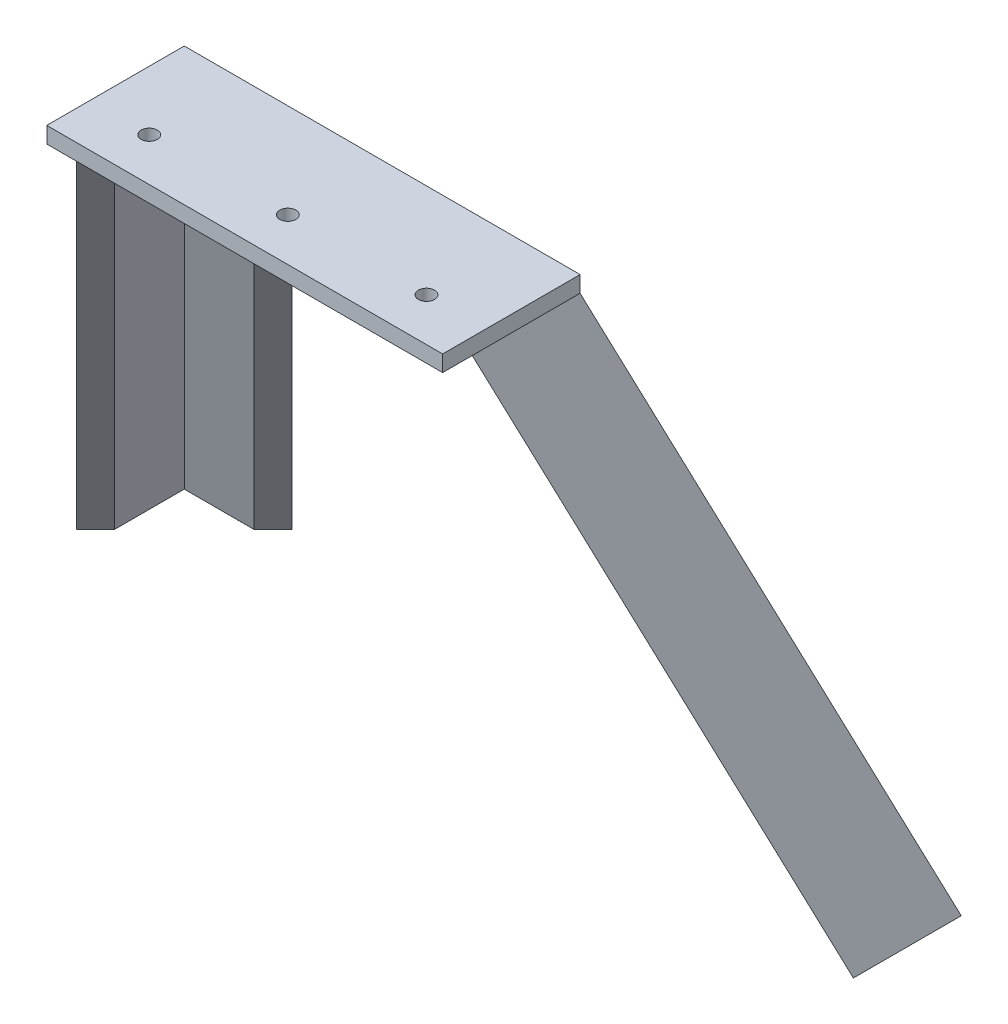
from build123d import *

# Parameters (mm, degrees)
SKETCH_8_W          = 73.42135624
SKETCH_8_H          = 25.5
EXTRUDE_3_DEPTH     = 3
SKETCH_9_R          = 1.5
CUT_EXTRUDE_2_DEPTH = 3


with BuildPart() as part:
    # 草图8 → 凸台-拉伸3 (new body)
    with BuildSketch(Plane(origin=(0, 100, 0), x_dir=(1, 0, 0), z_dir=(0, 1, 0))):
        with Locations((-11.084772404, 22.970398927)):
            Rectangle(SKETCH_8_W, SKETCH_8_H)
    extrude(amount=EXTRUDE_3_DEPTH)

    # 草图9 → 切除-拉伸2 (cut)
    with BuildSketch(Plane(origin=(0, 103, 0), x_dir=(1, 0, 0), z_dir=(0, 1, 0))):
        with Locations((-36.795450524, 18.220398927)):
            Circle(SKETCH_9_R)
        with Locations((14.625905716, 18.220398927)):
            Circle(SKETCH_9_R)
        with Locations((-11.084772404, 18.220398927)):
            Circle(SKETCH_9_R)
    extrude(amount=-CUT_EXTRUDE_2_DEPTH, mode=Mode.SUBTRACT)

    # 草图10 → 放样2 section 0
    with BuildSketch(Plane(origin=(0, 100, 0), x_dir=(1, 0, 0), z_dir=(0, 1, 0))):
        with BuildLine():
            Line((-47.795450524, 35.720398927), (-27.795450524, 35.720398927))
            Line((-27.795450524, 35.720398927), (-47.795450524, 15.720398927))
            Line((-47.795450524, 15.720398927), (-47.795450524, 35.720398927))
        make_face()
    # 草图11 → 放样2 section 1
    with BuildSketch(Plane(origin=(0, 0, 0), x_dir=(1, 0, 0), z_dir=(0, 1, 0))):
        with BuildLine():
            Line((-83.150789583, 71.075737986), (-63.150789583, 71.075737986))
            Line((-63.150789583, 71.075737986), (-83.150789583, 51.075737986))
            Line((-83.150789583, 51.075737986), (-83.150789583, 71.075737986))
        make_face()
    loft_2 = loft()

    # 草图12 → 切除-放样1 section 0
    with BuildSketch(Plane(origin=(0, 100, 0), x_dir=(1, 0, 0), z_dir=(0, 1, 0))):
        with BuildLine():
            Line((-31.33098443, 32.184865021), (-44.259916618, 19.255932833))
            Line((-44.259916618, 19.255932833), (-44.259916618, 32.184865021))
            Line((-44.259916618, 32.184865021), (-31.33098443, 32.184865021))
        make_face()
    # 草图13 → 切除-放样1 section 1
    with BuildSketch(Plane(origin=(0, 0, 0), x_dir=(1, 0, 0), z_dir=(0, 1, 0))):
        with BuildLine():
            Line((-66.686323489, 67.54020408), (-79.615255677, 54.611271892))
            Line((-79.615255677, 54.611271892), (-79.615255677, 67.54020408))
            Line((-79.615255677, 67.54020408), (-66.686323489, 67.54020408))
        make_face()
    loft_1 = loft(mode=Mode.SUBTRACT)

    # 镜向3: 放样2 across plane
    add(loft_2.mirror(Plane(origin=(-11.1, 0, 0), x_dir=(0, 0, 1), z_dir=(1, 0, 0))))

    # 镜向4: 切除-放样1 across plane
    add(loft_1.mirror(Plane(origin=(-11.1, 0, 0), x_dir=(0, 0, 1), z_dir=(1, 0, 0))), mode=Mode.SUBTRACT)


solid = part.part
